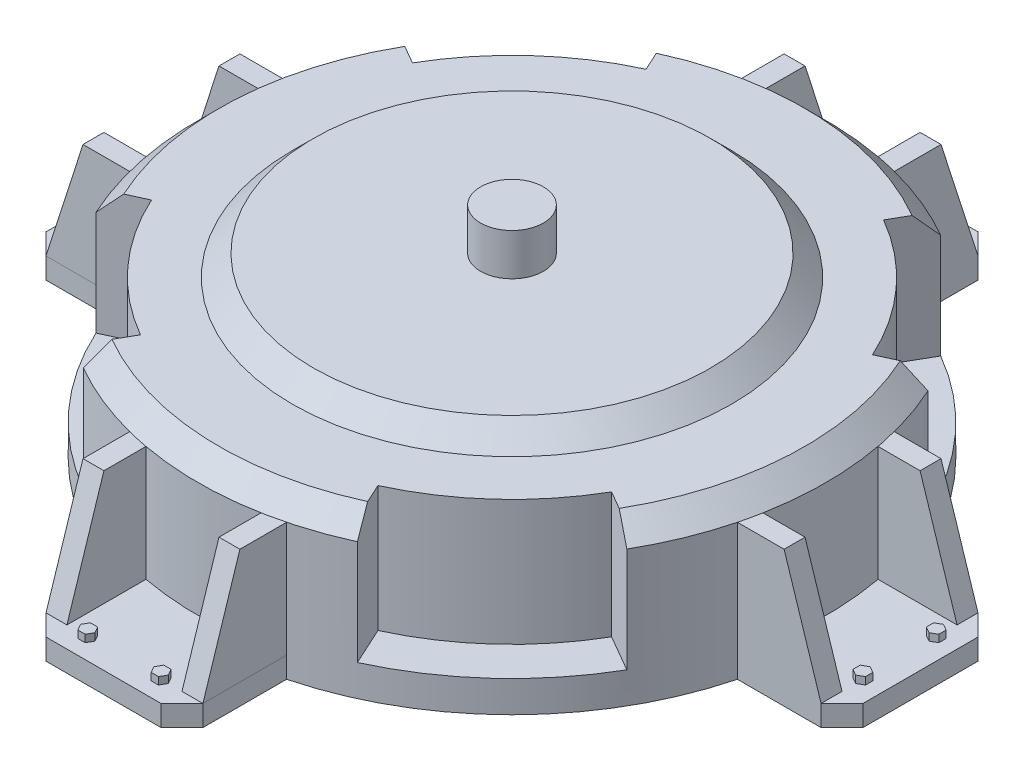
from build123d import *

# Parameters (mm, degrees)
SKETCH1_R           = 150
BOSS_EXTRUDE1_DEPTH = 75
CHAMFER1_SIZE       = 10
BOSS_EXTRUDE2_DEPTH = 10
CHAMFER2_SIZE       = 10
BOSS_EXTRUDE3_DEPTH = 10
BOSS_EXTRUDE4_DEPTH = 3.5
CIRPATTERN8_COUNT   = 4
CUT_EXTRUDE1_START  = -60
CUT_EXTRUDE1_DEPTH  = 60
SKETCH6_R           = 110
BOSS_EXTRUDE5_DEPTH = 10
CHAMFER3_SIZE       = 15
SKETCH7_R           = 15
BOSS_EXTRUDE6_DEPTH = 20
CIRPATTERN9_COUNT   = 4


with BuildPart() as part:
    # Sketch1 → Boss-Extrude1 (new body)
    with BuildSketch(Plane(origin=(0, 0, 0), x_dir=(1, 0, 0), z_dir=(0, 1, 0))):
        with Locations(Location((0, 0, 0), (0, 0, 270))):
            Circle(SKETCH1_R)
    extrude(amount=BOSS_EXTRUDE1_DEPTH)

    # Chamfer1
    chamfer1_edges = [part.edges().sort_by_distance(p)[0] for p in [
        (0, 75, -150),
    ]]
    chamfer(chamfer1_edges, length=CHAMFER1_SIZE)

    # Sketch2 → Boss-Extrude2 (add)
    with BuildSketch(Plane.XZ):
        with BuildLine():
            Line((-145.236875483, -37.5), (-195.236875483, -37.5))
            Line((-195.236875483, -37.5), (-195.236875483, 37.5))
            Line((-195.236875483, 37.5), (-145.236875483, 37.5))
            ThreePointArc((-145.236875483, 37.5), (-150, 0), (-145.236875483, -37.5))
        make_face()
    extrude(amount=-BOSS_EXTRUDE2_DEPTH)

    # Chamfer2
    chamfer2_edges = [part.edges().sort_by_distance(p)[0] for p in [
        (-195.236875483, 5, -37.5),
        (-195.236875483, 5, 37.5),
    ]]
    chamfer(chamfer2_edges, length=CHAMFER2_SIZE)

    # Sketch4 → Boss-Extrude4 (add)
    with BuildSketch(Plane(origin=(0, 10, 0), x_dir=(1, 0, 0), z_dir=(0, 1, 0))):
        Polygon((-185.236875483, -14.0657227), (-188.236875483, -15.797773507), (-188.236875483, -19.261875122), (-185.236875483, -20.99392593), (-182.236875483, -19.261875122), (-182.236875483, -15.797773507), align=None)
    boss_extrude4 = extrude(amount=BOSS_EXTRUDE4_DEPTH)


with BuildPart() as body_2:
    # Sketch3 → Boss-Extrude3 (new body)
    with BuildSketch(Plane.XY.offset(37.5)):
        Polygon((-185.236875483, 10), (-145.236875483, 10), (-145.236875483, 65), (-167.556875483, 65), align=None)
    boss_extrude3 = extrude(amount=-BOSS_EXTRUDE3_DEPTH)


with BuildPart() as part_1:
    add(part.part)

    # Mirror1: Boss-Extrude3, Boss-Extrude4 across plane
    add(boss_extrude3.mirror(Plane.XY))
    add(boss_extrude4.mirror(Plane.XY))


with BuildPart() as cirpattern8_1:
    # CirPattern8: pattern copy
    add(body_2.part.rotate(Axis((0, 0, 0), (0, 1, 0)), 1 * 360 / CIRPATTERN8_COUNT))


with BuildPart() as cirpattern8_2:
    # CirPattern8: pattern copy
    add(body_2.part.rotate(Axis((0, 0, 0), (0, 1, 0)), 2 * 360 / CIRPATTERN8_COUNT))


with BuildPart() as cirpattern8_3:
    # CirPattern8: pattern copy
    add(body_2.part.rotate(Axis((0, 0, 0), (0, 1, 0)), 3 * 360 / CIRPATTERN8_COUNT))


with BuildPart() as cirpattern8_4:
    # CirPattern8: pattern copy
    add(part_1.part.rotate(Axis((0, 0, 0), (0, 1, 0)), 1 * 360 / CIRPATTERN8_COUNT))


with BuildPart() as cirpattern8_5:
    # CirPattern8: pattern copy
    add(part_1.part.rotate(Axis((0, 0, 0), (0, 1, 0)), 2 * 360 / CIRPATTERN8_COUNT))


with BuildPart() as cirpattern8_6:
    # CirPattern8: pattern copy
    add(part_1.part.rotate(Axis((0, 0, 0), (0, 1, 0)), 3 * 360 / CIRPATTERN8_COUNT))


with BuildPart() as cut_extrude1_tool:
    # Sketch5 → Cut-Extrude1 (new body)
    with BuildSketch(Plane(origin=(0, 75, 0), x_dir=(1, 0, 0), z_dir=(0, 1, 0)).offset(CUT_EXTRUDE1_START)):
        with BuildLine():
            Line((-118.191247264, -54.137132082), (-136.374516074, -62.465921634))
            ThreePointArc((-136.374516074, -62.465921634), (-110.935854111, -100.96155839), (-75, -129.903810568))
            Line((-75, -129.903810568), (-65, -112.583302492))
            ThreePointArc((-65, -112.583302492), (-96.144406896, -87.500017272), (-118.191247264, -54.137132082))
        make_face()
    cut_extrude1 = extrude(amount=CUT_EXTRUDE1_DEPTH)


with BuildPart() as part_2:
    add(part_1.part)

    # Cut-Extrude1: cut by cut_extrude1_tool
    add(cut_extrude1_tool.part, mode=Mode.SUBTRACT)



with BuildPart() as cirpattern8_4_1:
    add(cirpattern8_4.part)

    # Cut-Extrude1: cut by cut_extrude1_tool
    add(cut_extrude1_tool.part, mode=Mode.SUBTRACT)


with BuildPart() as cirpattern8_5_1:
    add(cirpattern8_5.part)

    # Cut-Extrude1: cut by cut_extrude1_tool
    add(cut_extrude1_tool.part, mode=Mode.SUBTRACT)


with BuildPart() as cirpattern8_6_1:
    add(cirpattern8_6.part)

    # Cut-Extrude1: cut by cut_extrude1_tool
    add(cut_extrude1_tool.part, mode=Mode.SUBTRACT)


with BuildPart() as part_3:
    add(part_2.part)

    add(cirpattern8_4_1.part)  # Boss-Extrude5 merges CirPattern8_4

    add(cirpattern8_5_1.part)  # Boss-Extrude5 merges CirPattern8_5

    add(cirpattern8_6_1.part)  # Boss-Extrude5 merges CirPattern8_6
    # Sketch6 → Boss-Extrude5 (add)
    with BuildSketch(Plane(origin=(0, 75, 0), x_dir=(1, 0, 0), z_dir=(0, 1, 0))):
        with Locations(Location((0, 0, 0), (0, 0, 270))):
            Circle(SKETCH6_R)
    extrude(amount=BOSS_EXTRUDE5_DEPTH)

    # Chamfer3
    # the kernel refuses this chamfer: 15 mm, written as the material it takes off along each edge
    with BuildSketch(Plane(origin=(0, 85, 0), x_dir=(0, 0, 1), z_dir=(-1, 0, 0))) as chamfer3_piece_1_section:
        Polygon((110, -CHAMFER3_SIZE), (110 - CHAMFER3_SIZE, 0), (110, 0), align=None)
    chamfer3_piece_1 = revolve(axis=Axis((0, 85, 0), (0, 1, 0)), mode=Mode.PRIVATE)
    chamfer3_piece_1 = split(chamfer3_piece_1, bisect_by=Plane(origin=(0, 75, -100.081022807), z_dir=(0, 1, 0)), keep=Keep.TOP, mode=Mode.PRIVATE)
    add(chamfer3_piece_1, mode=Mode.SUBTRACT)

    # Sketch7 → Boss-Extrude6 (add)
    with BuildSketch(Plane(origin=(0, 85, 0), x_dir=(1, 0, 0), z_dir=(0, 1, 0))):
        with Locations(Location((0, 0, 0), (0, 0, 270))):
            Circle(SKETCH7_R)
    extrude(amount=BOSS_EXTRUDE6_DEPTH)

    # CirPattern9: Cut-Extrude1 ×4 about axis
    cirpattern9_axis = Axis((0, 0, 0), (0, -1, 0))
    for i in range(1, CIRPATTERN9_COUNT):
        add(cut_extrude1.rotate(cirpattern9_axis, i * 360 / CIRPATTERN9_COUNT), mode=Mode.SUBTRACT)


solid = Compound([body_2.part, cirpattern8_1.part, cirpattern8_2.part, cirpattern8_3.part, part_3.part])
